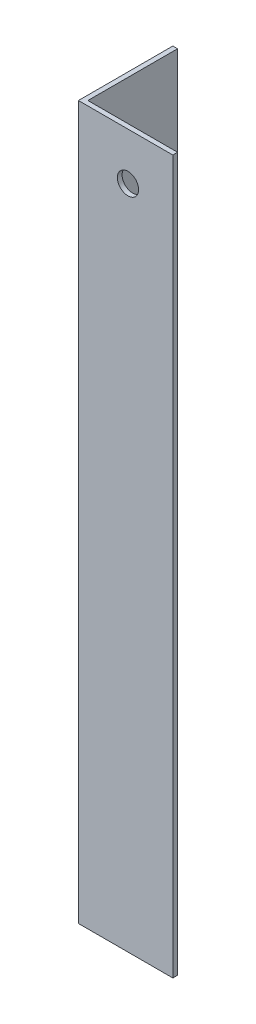
from build123d import *

# Parameters (mm, degrees)
EXTRUDE_1_DEPTH     = 151
SKETCH_2_R          = 2.25
CUT_EXTRUDE_1_DEPTH = 154.499185666
SKETCH_3_R          = 2.25
CUT_EXTRUDE_2_DEPTH = 154.499185666


with BuildPart() as part:
    # Эскиз1 → Бобышка-Вытянуть1 (new body)
    with BuildSketch(Plane(origin=(0, 0, 0), x_dir=(1, 0, 0), z_dir=(0, 1, 0))):
        Polygon((0, 0), (0, 20), (1, 20), (1, 1), (20, 1), (20, 0), align=None)
    extrude(amount=EXTRUDE_1_DEPTH)

    # Эскиз2 → Вырез-Вытянуть1 (cut, through all)
    with BuildSketch(Plane(origin=(0, 0, -1), x_dir=(-1, 0, 0), z_dir=(0, 0, -1))):
        with Locations((-10.5, 141)):
            Circle(SKETCH_2_R)
    extrude(amount=-CUT_EXTRUDE_1_DEPTH, mode=Mode.SUBTRACT)

    # Эскиз3 → Вырез-Вытянуть2 (cut, through all)
    with BuildSketch(Plane(origin=(1, 0, 0), x_dir=(0, 0, -1), z_dir=(1, 0, 0))):
        with Locations((10.5, 116.5)):
            Circle(SKETCH_3_R)
        with Locations((10.5, 9.5)):
            Circle(SKETCH_3_R)
    extrude(amount=-CUT_EXTRUDE_2_DEPTH, mode=Mode.SUBTRACT)


solid = part.part
